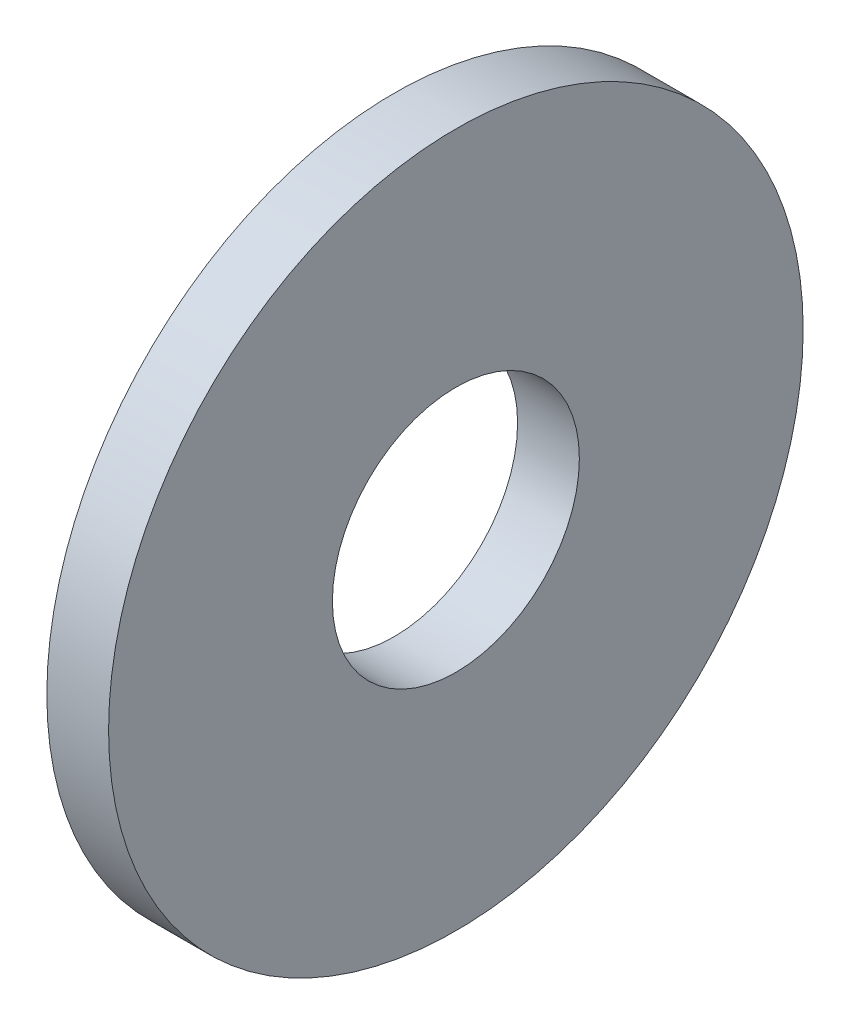
from build123d import *

# Parameters (mm, degrees)
SKETCH1_W = 1.6
SKETCH1_H = 5.8


with BuildPart() as part:
    # Sketch1 → Base-Revolve (revolve)
    with BuildSketch(Plane.XY):
        with Locations((-0.8, 6.1)):
            Rectangle(SKETCH1_W, SKETCH1_H)
    revolve(axis=Axis((-34.925, 0, 0), (1, 0, 0)))


solid = part.part
